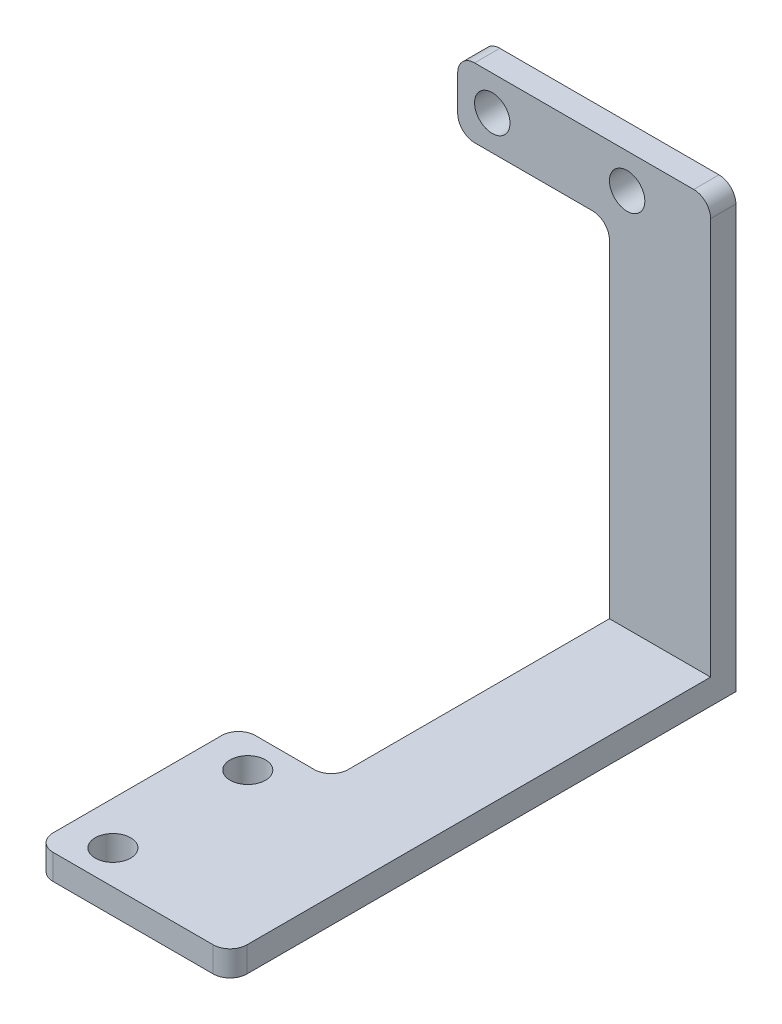
from build123d import *

# Parameters (mm, degrees)
SKETCH1_R           = 2.1
BOSS_EXTRUDE1_DEPTH = 3
SKETCH2_R           = 2.1
BOSS_EXTRUDE2_DEPTH = 3
FILLET1_R           = 2


with BuildPart() as part:
    # Sketch1 → Boss-Extrude1 (new body)
    with BuildSketch(Plane(origin=(0, 0, 0), x_dir=(1, 0, 0), z_dir=(0, 1, 0))):
        Polygon((-6, 0), (6, 0), (6, -57), (-17, -57), (-17, -33), (-6, -33), align=None)
        with Locations((-11.9, -37)):
            Circle(SKETCH1_R, mode=Mode.SUBTRACT)
        with Locations((-11.9, -53)):
            Circle(SKETCH1_R, mode=Mode.SUBTRACT)
    extrude(amount=BOSS_EXTRUDE1_DEPTH)

    # Sketch2 → Boss-Extrude2 (add)
    with BuildSketch(Plane.XY):
        Polygon((6, 0), (-6, 0), (-6, 43.9), (-24, 43.9), (-24, 52.1), (6, 52.1), align=None)
        with Locations((-19.9, 48)):
            Circle(SKETCH2_R, mode=Mode.SUBTRACT)
        with Locations((-3.9, 48)):
            Circle(SKETCH2_R, mode=Mode.SUBTRACT)
    extrude(amount=-BOSS_EXTRUDE2_DEPTH)

    # Fillet1
    fillet1_edges = [part.edges().sort_by_distance(p)[0] for p in [
        (-6, 1.5, 33),
        (6, 52.1, -1.5),
        (-24, 52.1, -1.5),
        (-24, 43.9, -1.5),
        (-6, 43.9, -1.5),
        (6, 1.5, 57),
        (-17, 1.5, 33),
        (-17, 1.5, 57),
    ]]
    fillet(fillet1_edges, radius=FILLET1_R)


solid = part.part
